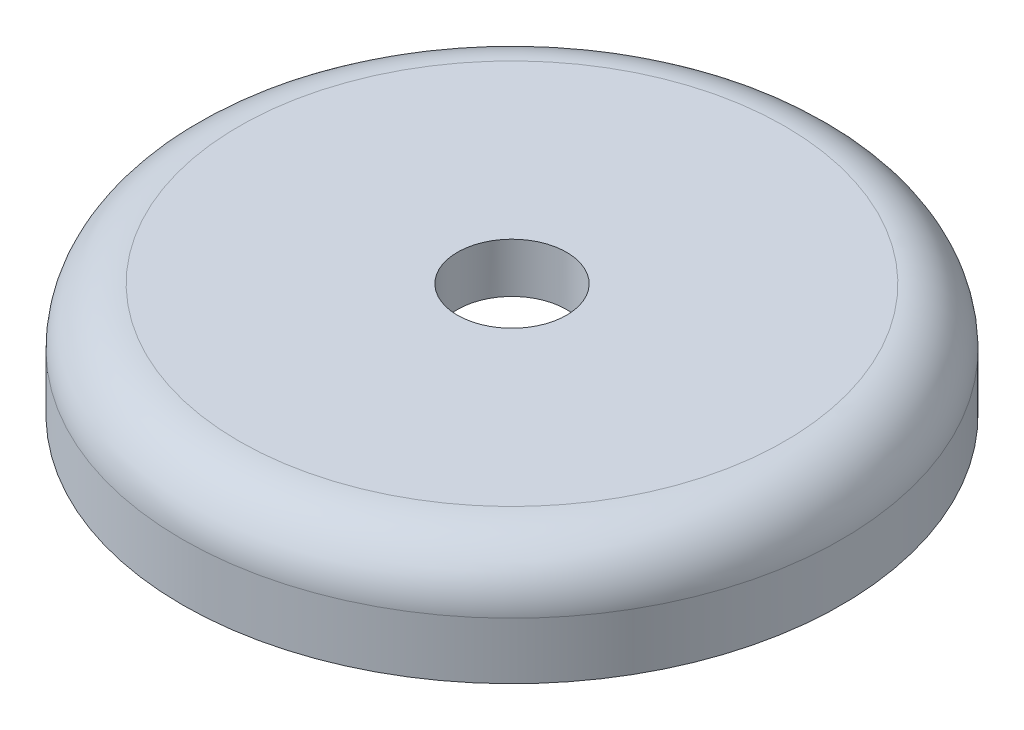
from build123d import *

# Parameters (mm, degrees)
SKETCH1_R           = 59.055
BOSS_EXTRUDE1_DEPTH = 20.32
SKETCH2_R           = 9.779
CUT_EXTRUDE1_DEPTH  = 86.952826888
FILLET1_R           = 10.16
SHELL2_T            = -5.08
CUT_EXTRUDE3_START  = -11.43
SKETCH4_R           = 14.859
SKETCH4_R_2         = 9.779
CUT_EXTRUDE3_DEPTH  = 11.43
FILLET3_R           = 5.08


with BuildPart() as part:
    # Sketch1 → Boss-Extrude1 (new body)
    with BuildSketch(Plane(origin=(0, 0, 0), x_dir=(1, 0, 0), z_dir=(0, 1, 0))):
        with Locations(Location((0, 0, 0), (0, 0, 270))):
            Circle(SKETCH1_R)
    extrude(amount=BOSS_EXTRUDE1_DEPTH)

    # Sketch2 → Cut-Extrude1 (cut, through all)
    with BuildSketch(Plane(origin=(0, 20.32, 0), x_dir=(1, 0, 0), z_dir=(0, 1, 0))):
        with Locations(Location((0, 0, 0), (0, 0, 270))):
            Circle(SKETCH2_R)
    extrude(amount=-CUT_EXTRUDE1_DEPTH, mode=Mode.SUBTRACT)

    # Fillet1
    fillet1_edges = [part.edges().sort_by_distance(p)[0] for p in [
        (0, 20.32, -59.055),
    ]]
    fillet(fillet1_edges, radius=FILLET1_R)

    # Shell2
    shell2_openings = [part.faces().sort_by_distance(p)[0] for p in [
        (0, 0, -57.384672361),
    ]]
    offset(amount=SHELL2_T, openings=shell2_openings, kind=Kind.INTERSECTION)

    # Sketch4 → Cut-Extrude3 (cut)
    with BuildSketch(Plane.XZ.offset(CUT_EXTRUDE3_START)):
        with Locations(Location((0, 0, 0), (0, 0, 90))):
            Circle(SKETCH4_R)
        with Locations(Location((0, 0, 0), (0, 0, 90))):
            Circle(SKETCH4_R_2, mode=Mode.SUBTRACT)
    extrude(amount=CUT_EXTRUDE3_DEPTH, mode=Mode.SUBTRACT)

    # Fillet3
    # the kernel refuses this fillet: 5.08 mm, written as the material it takes off along each edge
    with BuildSketch(Plane(origin=(0, 11.43, 0), x_dir=(0, 0, 1), z_dir=(1, 0, 0))) as fillet3_piece_1:
        with BuildLine():
            CenterArc((9.94031115, -5.08), FILLET3_R, 14.477512186, 75.522487814)
            Line((14.859, -3.81), (14.957373777, -3.7846))
            ThreePointArc((14.957373777, -3.7846), (14.9606, -1.905), (14.9606, 0))
            Line((14.9606, 0), (14.859, 0.1016))
            Line((14.859, 0.1016), (9.94031115, 0.1016))
            Line((9.94031115, 0.1016), (9.94031115, 0))
        make_face()
    revolve(axis=Axis((0, 11.43, 0), (0, -1, 0)), mode=Mode.SUBTRACT)


solid = part.part
